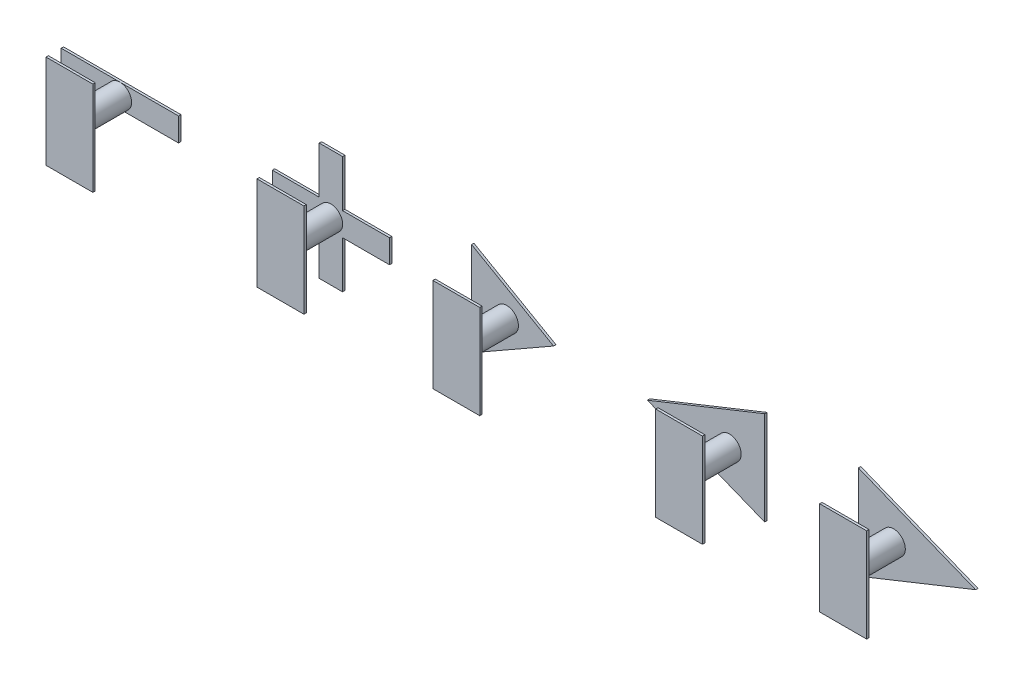
from build123d import *

# Parameters (mm, degrees)
BOSS_EXTRUDE1_DEPTH   = 0.2
SKETCH8_W             = 10
SKETCH8_H             = 2
BOSS_EXTRUDE1_2_DEPTH = 0.2
BOSS_EXTRUDE1_3_DEPTH = 0.2
BOSS_EXTRUDE1_4_DEPTH = 0.2
BOSS_EXTRUDE1_5_DEPTH = 0.2
SKETCH10_R            = 1
BOSS_EXTRUDE2_DEPTH   = 4.5
BOSS_EXTRUDE2_2_DEPTH = 4.5
BOSS_EXTRUDE2_3_DEPTH = 4.5
BOSS_EXTRUDE2_4_DEPTH = 4.5
BOSS_EXTRUDE2_5_DEPTH = 4.5
SKETCH11_W            = 4
SKETCH11_H            = 8
BOSS_EXTRUDE3_DEPTH   = 0.2


with BuildPart() as part:
    # Sketch8 → Boss-Extrude1 (new body)
    with BuildSketch(Plane.XY.offset(0.5)):
        Polygon((-21, 1), (-17, 1), (-17, 5), (-15, 5), (-15, 1), (-11, 1), (-11, -1), (-15, -1), (-15, -5), (-17, -5), (-17, -1), (-21, -1), align=None)
    extrude(amount=BOSS_EXTRUDE1_DEPTH)


with BuildPart() as body_2:
    # Sketch8 → Boss-Extrude1 2 (new body)
    with BuildSketch(Plane.XY.offset(0.5)):
        with Locations((-34, 0)):
            Rectangle(SKETCH8_W, SKETCH8_H)
    extrude(amount=BOSS_EXTRUDE1_2_DEPTH)


with BuildPart() as body_3:
    # Sketch8 → Boss-Extrude1 3 (new body)
    with BuildSketch(Plane.XY.offset(0.5)):
        Polygon((-4, 4), (-4, -4), (3, 0), align=None)
    extrude(amount=BOSS_EXTRUDE1_3_DEPTH)


with BuildPart() as body_4:
    # Sketch8 → Boss-Extrude1 4 (new body)
    with BuildSketch(Plane.XY.offset(0.5)):
        Polygon((29, 4), (29, -4), (39, 0), align=None)
    extrude(amount=BOSS_EXTRUDE1_4_DEPTH)


with BuildPart() as body_5:
    # Sketch8 → Boss-Extrude1 5 (new body)
    with BuildSketch(Plane.XY.offset(0.5)):
        Polygon((11, 0), (21, -4), (21, 4), align=None)
    extrude(amount=BOSS_EXTRUDE1_5_DEPTH)


with BuildPart() as body_6:
    # Sketch10 → Boss-Extrude2 (new body)
    with BuildSketch(Plane.XY.offset(5)):
        with Locations((-34, 0)):
            Circle(SKETCH10_R)
    extrude(amount=-BOSS_EXTRUDE2_DEPTH)



with BuildPart() as body_7:
    # Sketch10 → Boss-Extrude2 2 (new body)
    with BuildSketch(Plane.XY.offset(5)):
        with Locations((-16, 0)):
            Circle(SKETCH10_R)
    extrude(amount=-BOSS_EXTRUDE2_2_DEPTH)


with BuildPart() as body_8:
    # Sketch10 → Boss-Extrude2 3 (new body)
    with BuildSketch(Plane.XY.offset(5)):
        with Locations((-1, 0)):
            Circle(SKETCH10_R)
    extrude(amount=-BOSS_EXTRUDE2_3_DEPTH)


with BuildPart() as body_9:
    # Sketch10 → Boss-Extrude2 4 (new body)
    with BuildSketch(Plane.XY.offset(5)):
        with Locations((18, 0)):
            Circle(SKETCH10_R)
    extrude(amount=-BOSS_EXTRUDE2_4_DEPTH)


with BuildPart() as body_10:
    # Sketch10 → Boss-Extrude2 5 (new body)
    with BuildSketch(Plane.XY.offset(5)):
        with Locations((32, 0)):
            Circle(SKETCH10_R)
    extrude(amount=-BOSS_EXTRUDE2_5_DEPTH)


with BuildPart() as body_6_1:
    add(body_6.part)

    add(body_7.part)  # Boss-Extrude3 merges body 7

    add(body_8.part)  # Boss-Extrude3 merges body 8

    add(body_9.part)  # Boss-Extrude3 merges body 9

    add(body_10.part)  # Boss-Extrude3 merges body 10
    # Sketch11 → Boss-Extrude3 (add)
    with BuildSketch(Plane.XY.offset(5)):
        with Locations((-34, 0)):
            Rectangle(SKETCH11_W, SKETCH11_H)
        with Locations((-16, 0)):
            Rectangle(SKETCH11_W, SKETCH11_H)
        with Locations((-1, 0)):
            Rectangle(SKETCH11_W, SKETCH11_H)
        with Locations((18, 0)):
            Rectangle(SKETCH11_W, SKETCH11_H)
        with Locations((32, 0)):
            Rectangle(SKETCH11_W, SKETCH11_H)
    extrude(amount=-BOSS_EXTRUDE3_DEPTH)


solid = Compound([part.part, body_2.part, body_3.part, body_4.part, body_5.part, body_6_1.part])
